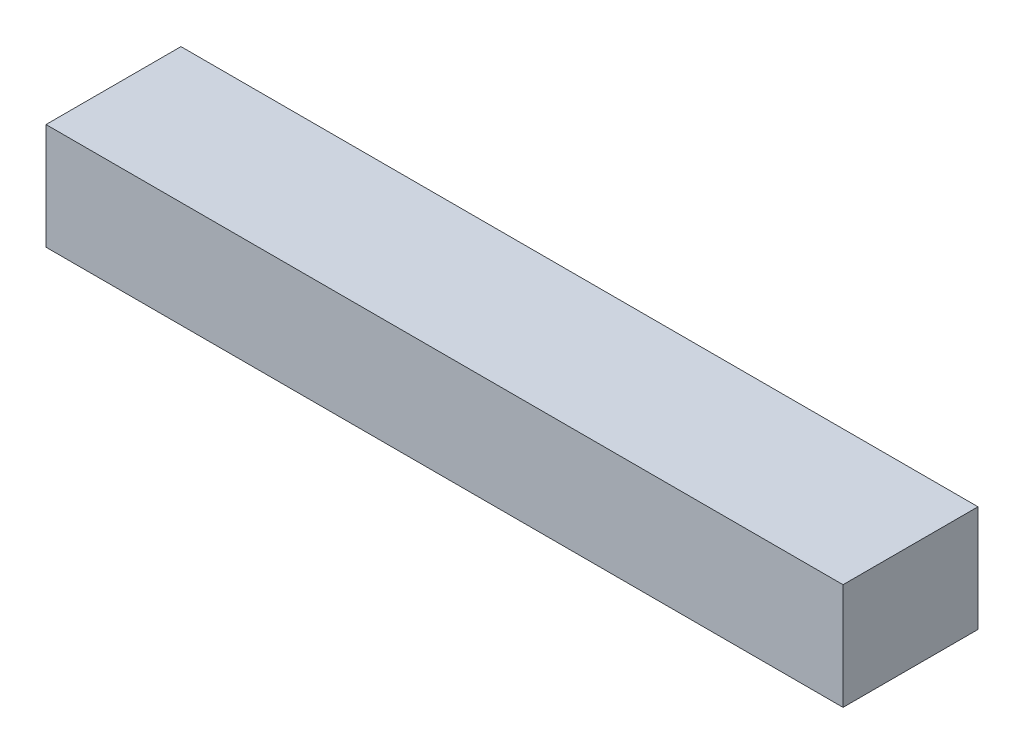
from build123d import *

# Parameters (mm, degrees)
SKETCH1_W           = 75
SKETCH1_H           = 12.7
BOSS_EXTRUDE1_DEPTH = 10


with BuildPart() as part:
    # Sketch1 → Boss-Extrude1 (new body)
    with BuildSketch(Plane(origin=(0, 0, 0), x_dir=(1, 0, 0), z_dir=(0, 1, 0))):
        Rectangle(SKETCH1_W, SKETCH1_H)
    extrude(amount=BOSS_EXTRUDE1_DEPTH)


solid = part.part
